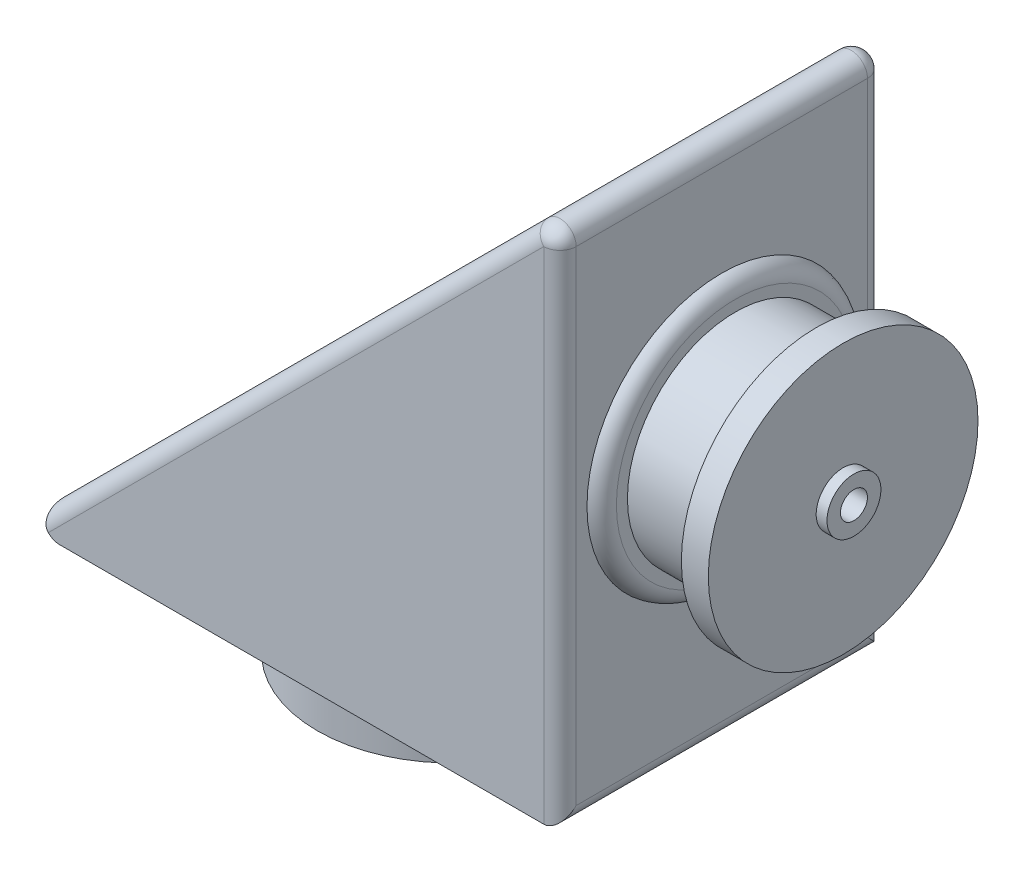
from build123d import *

# Parameters (mm, degrees)
BOSS_EXTRUDE1_DEPTH = 30
FILLET1_R           = 3
SKETCH2_R           = 25
BOSS_EXTRUDE2_DEPTH = 11
SKETCH3_R           = 25
BOSS_EXTRUDE3_DEPTH = 2.5
FILLET2_R           = 3
SKETCH5_R           = 20
BOSS_EXTRUDE4_DEPTH = 15
SKETCH6_R           = 25
BOSS_EXTRUDE5_DEPTH = 5
SKETCH7_R           = 5
BOSS_EXTRUDE6_DEPTH = 2
SKETCH8_R           = 2.5
CUT_EXTRUDE2_DEPTH  = 10


with BuildPart() as part:
    # Sketch1 → Boss-Extrude1 (new, symmetric)
    with BuildSketch(Plane.XY):
        Polygon((0, 0), (100, 0), (100, 100), align=None)
    extrude(amount=BOSS_EXTRUDE1_DEPTH, both=True)

    # Fillet1
    fillet1_edges = [part.edges().sort_by_distance(p)[0] for p in [
        (100, 50, 30),
        (100, 50, -30),
        (50, 50, -30),
        (50, 50, 30),
        (100, 100, 0),
        (100, 0, 0),
        (0, 0, 0),
    ]]
    fillet(fillet1_edges, radius=FILLET1_R)

    # Sketch2 → Boss-Extrude2 (add, symmetric)
    with BuildSketch(Plane.XZ):
        with Locations(Location((50, 0, 0), (0, 0, 90))):
            Circle(SKETCH2_R)
    extrude(amount=BOSS_EXTRUDE2_DEPTH, both=True)

    # Sketch3 → Boss-Extrude3 (add, symmetric)
    with BuildSketch(Plane(origin=(100, 0, 0), x_dir=(0, 0, -1), z_dir=(1, 0, 0))):
        with Locations(Location((0, 50, 0), (0, 0, 180))):
            Circle(SKETCH3_R)
    extrude(amount=BOSS_EXTRUDE3_DEPTH, both=True)

    # Fillet2
    # the kernel refuses this fillet: 3 mm, written as the material it takes off along each edge
    with BuildSketch(Plane(origin=(102.5, 50, 0), x_dir=(0, 0, 1), z_dir=(0, 1, 0))) as fillet2_piece_1:
        with BuildLine():
            CenterArc((22.041960108, -3), FILLET2_R, 9.594068227, 80.405931773)
            Line((22.041960108, 0), (22.041960108, 0.06))
            Line((22.041960108, 0.06), (25, 0.06))
            Line((25, 0.06), (25.06, 0))
            ThreePointArc((25.06, 0), (25.06, -1.25), (25.059160798, -2.49))
            Line((25.059160798, -2.49), (25, -2.5))
        make_face()
    revolve(axis=Axis((102.5, 50, 0), (1, 0, 0)), mode=Mode.SUBTRACT)

    # Sketch5 → Boss-Extrude4 (add)
    with BuildSketch(Plane(origin=(102.5, 0, 0), x_dir=(0, 0, -1), z_dir=(1, 0, 0))):
        with Locations((0, 50)):
            Circle(SKETCH5_R)
    extrude(amount=BOSS_EXTRUDE4_DEPTH)

    # Sketch6 → Boss-Extrude5 (add)
    with BuildSketch(Plane(origin=(117.5, 0, 0), x_dir=(0, 0, -1), z_dir=(1, 0, 0))):
        with Locations((0, 50)):
            Circle(SKETCH6_R)
    extrude(amount=BOSS_EXTRUDE5_DEPTH)

    # Sketch7 → Boss-Extrude6 (add)
    with BuildSketch(Plane(origin=(122.5, 0, 0), x_dir=(0, 0, -1), z_dir=(1, 0, 0))):
        with Locations((0, 50)):
            Circle(SKETCH7_R)
    extrude(amount=BOSS_EXTRUDE6_DEPTH)

    # Sketch8 → Cut-Extrude2 (cut)
    with BuildSketch(Plane(origin=(124.5, 0, 0), x_dir=(0, 0, -1), z_dir=(1, 0, 0))):
        with Locations((0, 50)):
            Circle(SKETCH8_R)
    extrude(amount=-CUT_EXTRUDE2_DEPTH, mode=Mode.SUBTRACT)


solid = part.part
